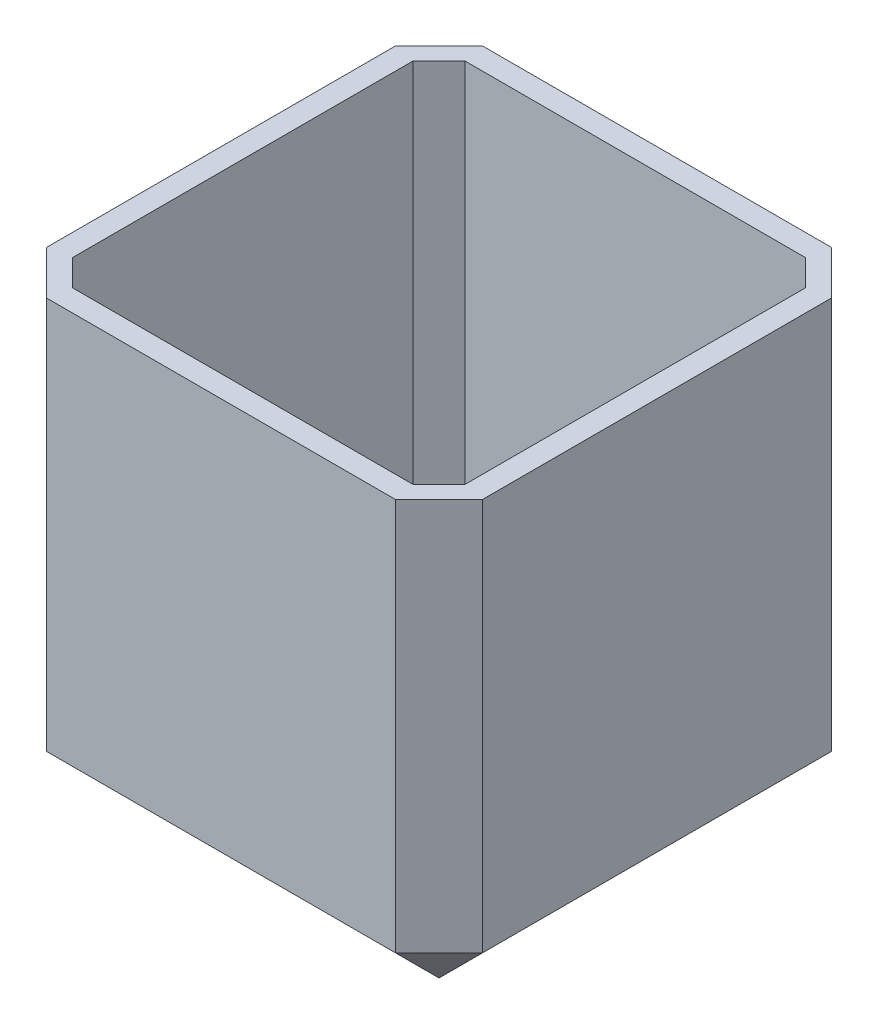
from build123d import *

# Parameters (mm, degrees)
SKETCH1_W           = 50
SKETCH1_H           = 50
BOSS_EXTRUDE1_DEPTH = 50
SKETCH2_W           = 45
SKETCH2_H           = 45
CUT_EXTRUDE1_DEPTH  = 45
FILLET2_SIZE        = 5
FILLET3_SIZE        = 3


with BuildPart() as part:
    # Sketch1 → Boss-Extrude1 (new body)
    with BuildSketch(Plane(origin=(0, 0, 0), x_dir=(1, 0, 0), z_dir=(0, 1, 0))):
        Rectangle(SKETCH1_W, SKETCH1_H)
    extrude(amount=BOSS_EXTRUDE1_DEPTH)

    # Sketch2 → Cut-Extrude1 (cut)
    with BuildSketch(Plane(origin=(0, 50, 0), x_dir=(1, 0, 0), z_dir=(0, 1, 0))):
        Rectangle(SKETCH2_W, SKETCH2_H)
    extrude(amount=-CUT_EXTRUDE1_DEPTH, mode=Mode.SUBTRACT)

    # Fillet2
    fillet2_edges = [part.edges().sort_by_distance(p)[0] for p in [
        (0, 0, 25),
        (-25, 0, 0),
        (0, 0, -25),
        (25, 0, 0),
        (25, 25, 25),
        (-25, 25, 25),
        (-25, 25, -25),
        (25, 25, -25),
    ]]
    chamfer(fillet2_edges, length=FILLET2_SIZE - 0.0001)  # a hair under: the kernel refuses the full size

    # Fillet3
    fillet3_edges = [part.edges().sort_by_distance(p)[0] for p in [
        (-22.5, 27.5, -22.5),
        (-22.5, 27.5, 22.5),
        (22.5, 27.5, 22.5),
        (22.5, 27.5, -22.5),
    ]]
    chamfer(fillet3_edges, length=FILLET3_SIZE)


solid = part.part
